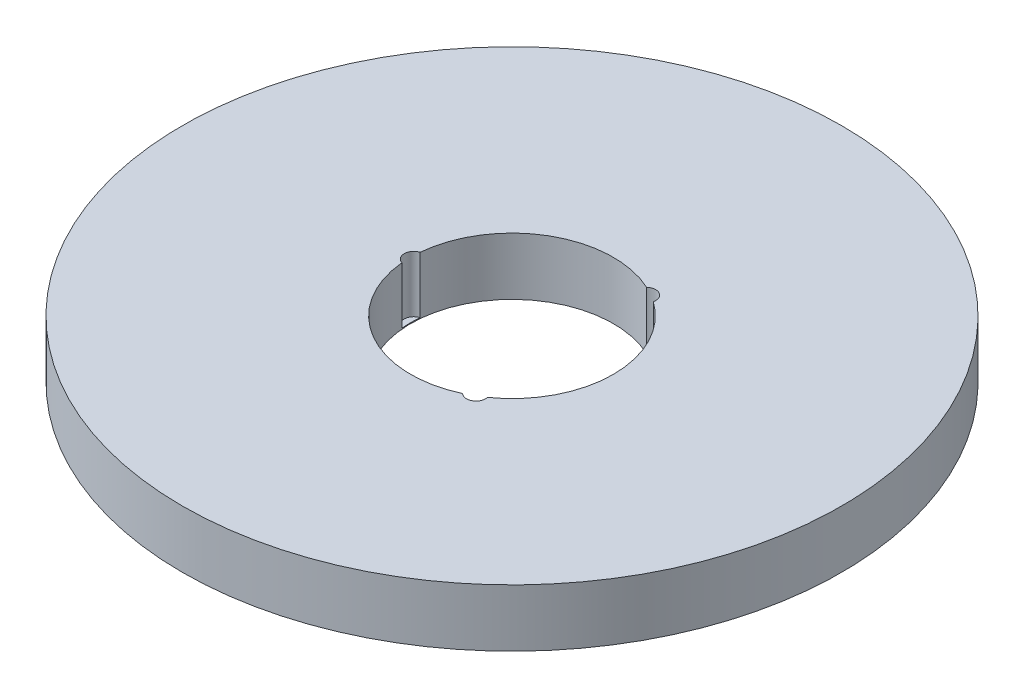
from build123d import *

# Parameters (mm, degrees)
SKETCH1_R           = 97.5
BOSS_EXTRUDE1_DEPTH = 17
SKETCH2_R           = 30
CUT_EXTRUDE1_DEPTH  = 139.929838408
SKETCH3_R           = 2.817336433
CUT_EXTRUDE2_DEPTH  = 16.750580506
CIRPATTERN1_COUNT   = 3


with BuildPart() as part:
    # Sketch1 → Boss-Extrude1 (new body)
    with BuildSketch(Plane(origin=(0, 0, 0), x_dir=(1, 0, 0), z_dir=(0, 1, 0))):
        Circle(SKETCH1_R)
    extrude(amount=BOSS_EXTRUDE1_DEPTH)

    # Sketch2 → Cut-Extrude1 (cut, through all)
    with BuildSketch(Plane(origin=(0, 0, 0), x_dir=(1, 0, 0), z_dir=(0, 1, 0))):
        Circle(SKETCH2_R)
    extrude(amount=CUT_EXTRUDE1_DEPTH, mode=Mode.SUBTRACT)

    # Sketch3 → Cut-Extrude2 (cut)
    with BuildSketch(Plane(origin=(0, 17, 0), x_dir=(1, 0, 0), z_dir=(0, 1, 0))):
        with Locations((-29.059479552, 0)):
            Circle(SKETCH3_R)
    cut_extrude2 = extrude(amount=-CUT_EXTRUDE2_DEPTH, mode=Mode.SUBTRACT)

    # CirPattern1: Cut-Extrude2 ×3 about axis
    cirpattern1_axis = Axis((0, 0, 0), (0, 1, 0))
    for i in range(1, CIRPATTERN1_COUNT):
        add(cut_extrude2.rotate(cirpattern1_axis, i * 360 / CIRPATTERN1_COUNT), mode=Mode.SUBTRACT)


solid = part.part
